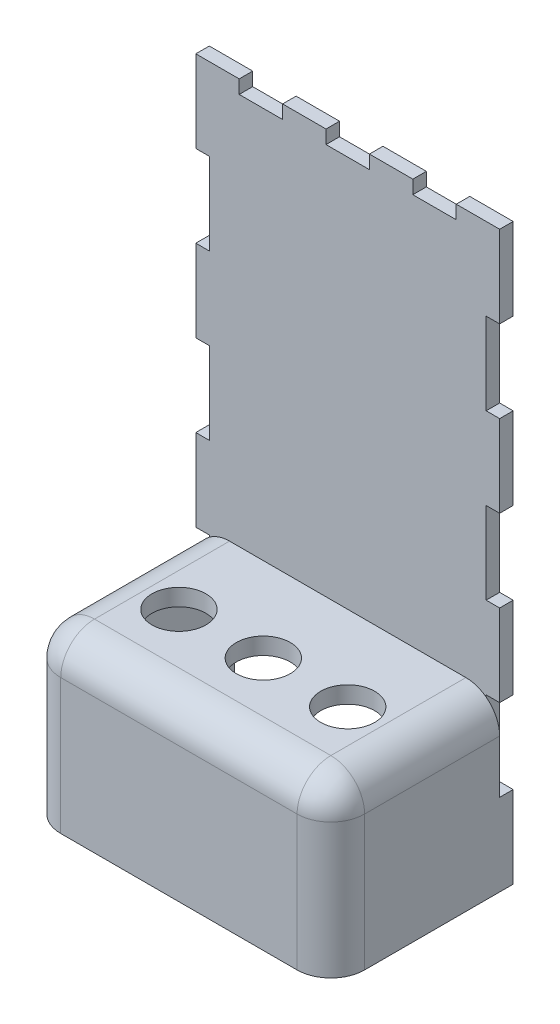
from build123d import *

# Parameters (mm, degrees)
BUITENAFMETING_RECHTHOEK_W  = 90
BUITENAFMETING_RECHTHOEK_H  = 170
PLAAT_DEPTH                 = 4
TAND_HOR_W                  = 12.857142857
TAND_HOR_H                  = 4
TAND_BOVEN_DEPTH            = 193.395426141
TANDEN_PATROON_BOVEN_COUNT  = 3
TANDEN_PATROON_BOVEN_PITCH  = 25.714285714
TAND_VER_W                  = 4
TAND_VER_H                  = 24.285714285
TAND_LINKS_DEPTH            = 193.395426141
TANDEN_PATROON_LINKS_COUNT  = 3
TANDEN_PATROON_LINKS_PITCH  = 48.571428571
TAND_O_W                    = 12.857142857
TAND_O_H                    = 4
TAND_ONDER_DEPTH            = 193.395426141
TANDEN_PATROON_ONDER_COUNT  = 3
TANDEN_PATROON_ONDER_PITCH  = 25.714285714
TAND_R_W                    = 4
TAND_R_H                    = 24.285714285
TAND_RECHTS_DEPTH           = 193.395426141
TANDEN_PATROON_RECHTS_COUNT = 3
TANDEN_PATROON_RECHTS_PITCH = 48.571428571
SKETCH1_W                   = 90
SKETCH1_H                   = 50
BOSS_EXTRUDE1_DEPTH         = 50
SKETCH2_W                   = 75
SKETCH2_H                   = 40
CUT_EXTRUDE1_DEPTH          = 50
SKETCH3_R                   = 8
CUT_EXTRUDE3_DEPTH          = 24
FILLET1_R                   = 10


with BuildPart() as part:
    # Buitenafmeting Rechthoek → Plaat (new body)
    with BuildSketch(Plane.XY):
        with Locations((45, 85)):
            Rectangle(BUITENAFMETING_RECHTHOEK_W, BUITENAFMETING_RECHTHOEK_H)
    extrude(amount=-PLAAT_DEPTH)

    # Tand Hor → Tand Boven (cut, through all)
    with BuildSketch(Plane.XY):
        with Locations((19.285714286, 168)):
            Rectangle(TAND_HOR_W, TAND_HOR_H)
    tand_boven = extrude(amount=-TAND_BOVEN_DEPTH, mode=Mode.SUBTRACT)

    # Tanden Patroon Boven: Tand Boven ×3
    with Locations(*[(i * TANDEN_PATROON_BOVEN_PITCH, 0, 0) for i in range(1, TANDEN_PATROON_BOVEN_COUNT)]):
        add(tand_boven, mode=Mode.SUBTRACT)

    # Tand Ver → Tand Links (cut, through all)
    with BuildSketch(Plane.XY):
        with Locations((2, 133.571428572)):
            Rectangle(TAND_VER_W, TAND_VER_H)
    tand_links = extrude(amount=-TAND_LINKS_DEPTH, mode=Mode.SUBTRACT)

    # Tanden Patroon Links: Tand Links ×3
    with Locations(*[(0, -i * TANDEN_PATROON_LINKS_PITCH, 0) for i in range(1, TANDEN_PATROON_LINKS_COUNT)]):
        add(tand_links, mode=Mode.SUBTRACT)

    # Tand O → Tand Onder (cut, through all)
    with BuildSketch(Plane.XY):
        with Locations((19.285714286, 2)):
            Rectangle(TAND_O_W, TAND_O_H)
    tand_onder = extrude(amount=-TAND_ONDER_DEPTH, mode=Mode.SUBTRACT)

    # Tanden Patroon Onder: Tand Onder ×3
    with Locations(*[(i * TANDEN_PATROON_ONDER_PITCH, 0, 0) for i in range(1, TANDEN_PATROON_ONDER_COUNT)]):
        add(tand_onder, mode=Mode.SUBTRACT)

    # Tand R → Tand Rechts (cut, through all)
    with BuildSketch(Plane.XY):
        with Locations((88, 133.571428572)):
            Rectangle(TAND_R_W, TAND_R_H)
    tand_rechts = extrude(amount=-TAND_RECHTS_DEPTH, mode=Mode.SUBTRACT)

    # Tanden Patroon Rechts: Tand Rechts ×3
    with Locations(*[(0, -i * TANDEN_PATROON_RECHTS_PITCH, 0) for i in range(1, TANDEN_PATROON_RECHTS_COUNT)]):
        add(tand_rechts, mode=Mode.SUBTRACT)

    # Sketch1 → Boss-Extrude1 (add)
    with BuildSketch(Plane.XY):
        with Locations((45, 25)):
            Rectangle(SKETCH1_W, SKETCH1_H)
    extrude(amount=BOSS_EXTRUDE1_DEPTH)

    # Sketch2 → Cut-Extrude1 (cut)
    with BuildSketch(Plane(origin=(0, 0, -4), x_dir=(-1, 0, 0), z_dir=(0, 0, -1))):
        with Locations((-45, 25)):
            Rectangle(SKETCH2_W, SKETCH2_H)
    extrude(amount=-CUT_EXTRUDE1_DEPTH, mode=Mode.SUBTRACT)

    # Sketch3 → Cut-Extrude3 (cut)
    with BuildSketch(Plane(origin=(0, 50, 0), x_dir=(1, 0, 0), z_dir=(0, 1, 0))):
        with Locations(Location((45, -25, 0), (0, 0, 270))):
            Circle(SKETCH3_R)
        with Locations(Location((70, -25, 0), (0, 0, 270))):
            Circle(SKETCH3_R)
        with Locations(Location((20, -25, 0), (0, 0, 270))):
            Circle(SKETCH3_R)
    extrude(amount=-CUT_EXTRUDE3_DEPTH, mode=Mode.SUBTRACT)

    # Fillet1
    # the kernel refuses this fillet: 10 mm, written as the material it takes off along each edge
    with BuildSketch(Plane(origin=(10, 40, 40), x_dir=(0, 0, 1), z_dir=(0, 1, 0))) as fillet1_piece_1_section:
        Polygon((0, 0), (FILLET1_R * 1.02, 0), (FILLET1_R * 1.02, -FILLET1_R * 1.02), (0, -FILLET1_R * 1.02), align=None)
    fillet1_piece_1 = extrude(amount=FILLET1_R * 1.02, mode=Mode.PRIVATE)
    fillet1_piece_1 = fillet1_piece_1 - Plane(origin=(10, 40, 40), x_dir=(0.7071067811865475, 0, -0.7071067811865475), z_dir=(0, 1, 0)) * Sphere(FILLET1_R, mode=Mode.PRIVATE)
    add(fillet1_piece_1, mode=Mode.SUBTRACT)
    with BuildSketch(Plane(origin=(80, 40, 40), x_dir=(1, 0, 0), z_dir=(0, 1, 0))) as fillet1_piece_2_section:
        Polygon((0, 0), (FILLET1_R * 1.02, 0), (FILLET1_R * 1.02, -FILLET1_R * 1.02), (0, -FILLET1_R * 1.02), align=None)
    fillet1_piece_2 = extrude(amount=FILLET1_R * 1.02, mode=Mode.PRIVATE)
    fillet1_piece_2 = fillet1_piece_2 - Plane(origin=(80, 40, 40), x_dir=(-0.7071067811865475, 0, -0.7071067811865475), z_dir=(0, 1, 0)) * Sphere(FILLET1_R, mode=Mode.PRIVATE)
    add(fillet1_piece_2, mode=Mode.SUBTRACT)
    with BuildSketch(Plane(origin=(0, 50, 0), x_dir=(0, -1, 0), z_dir=(0, 0, 1))) as fillet1_piece_3:
        with BuildLine():
            CenterArc((FILLET1_R, FILLET1_R), FILLET1_R, 180, 90)
            Line((0, FILLET1_R), (0, 0))
            Line((0, 0), (FILLET1_R, 0))
        make_face()
    extrude(amount=40, mode=Mode.SUBTRACT)
    with BuildSketch(Plane(origin=(90, 50, 0), x_dir=(0, -1, 0), z_dir=(0, 0, 1))) as fillet1_piece_4:
        with BuildLine():
            CenterArc((FILLET1_R, -FILLET1_R), FILLET1_R, 90, 90)
            Line((0, -FILLET1_R), (0, 0))
            Line((0, 0), (FILLET1_R, 0))
        make_face()
    extrude(amount=40, mode=Mode.SUBTRACT)
    with BuildSketch(Plane(origin=(0, 40, 50), x_dir=(1, 0, 0), z_dir=(0, -1, 0))) as fillet1_piece_5:
        with BuildLine():
            CenterArc((FILLET1_R, -FILLET1_R), FILLET1_R, 90, 90)
            Line((0, -FILLET1_R), (0, 0))
            Line((0, 0), (FILLET1_R, 0))
        make_face()
    extrude(amount=65, mode=Mode.SUBTRACT)
    with BuildSketch(Plane(origin=(90, -25, 50), x_dir=(0, 0, -1), z_dir=(0, 1, 0))) as fillet1_piece_6:
        with BuildLine():
            CenterArc((FILLET1_R, FILLET1_R), FILLET1_R, 180, 90)
            Line((0, FILLET1_R), (0, 0))
            Line((0, 0), (FILLET1_R, 0))
        make_face()
    extrude(amount=65, mode=Mode.SUBTRACT)
    with BuildSketch(Plane(origin=(80, 50, 50), x_dir=(0, -1, 0), z_dir=(-1, 0, 0))) as fillet1_piece_7:
        with BuildLine():
            CenterArc((FILLET1_R, -FILLET1_R), FILLET1_R, 90, 90)
            Line((0, -FILLET1_R), (0, 0))
            Line((0, 0), (FILLET1_R, 0))
        make_face()
    extrude(amount=70, mode=Mode.SUBTRACT)


solid = part.part
